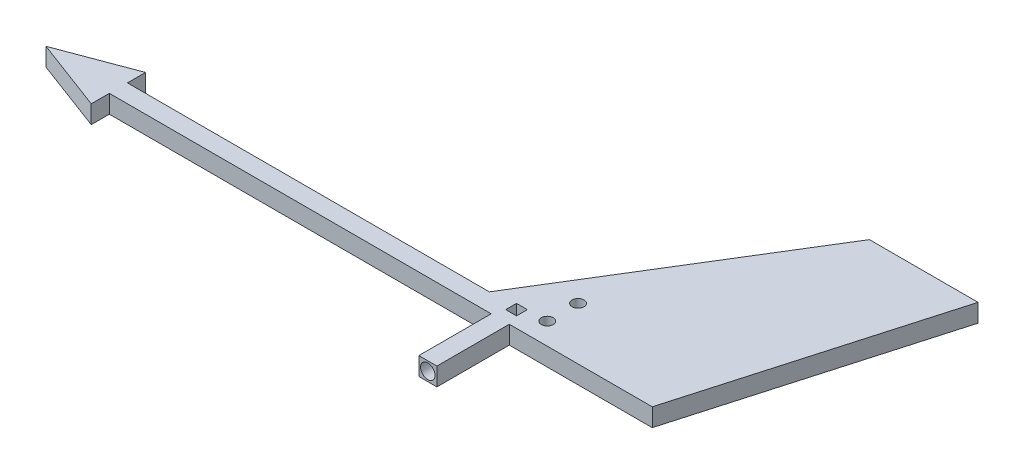
from build123d import *

# Parameters (mm, degrees)
BOSS_EXTRUDE1_DEPTH = 2.5
CUT_EXTRUDE2_DEPTH  = 2.5
SKETCH3_W           = 5
SKETCH3_H           = 5
BOSS_EXTRUDE2_DEPTH = 20
SKETCH4_R           = 2
CUT_EXTRUDE3_DEPTH  = 23
SKETCH6_W           = 3
SKETCH6_H           = 3
CUT_EXTRUDE5_DEPTH  = 4.5
SKETCH7_R           = 1.65
CUT_EXTRUDE6_DEPTH  = 183.978823911


with BuildPart() as part:
    # Sketch1 → Boss-Extrude1 (new, symmetric)
    with BuildSketch(Plane(origin=(0, 0, 0), x_dir=(1, 0, 0), z_dir=(0, 1, 0))):
        Polygon((-20, 0), (0, 7.5), (0, 2.5), (100, 2.5), (140, 67.5), (170, 67.5), (150, -2.5), (0, -2.5), (0, -7.5), align=None)
    extrude(amount=BOSS_EXTRUDE1_DEPTH, both=True)

    # Sketch2 → Cut-Extrude2 (cut)
    with BuildSketch(Plane(origin=(0, -2.5, 0), x_dir=(1, 0, 0), z_dir=(0, 1, 0))):
        Polygon((118.233161507, 12), (116.616580754, 14.8), (113.383419246, 14.8), (111.766838493, 12), (113.383419246, 9.2), (116.616580754, 9.2), align=None)
        Polygon((118.233161507, 3.5), (116.616580754, 6.3), (113.383419246, 6.3), (111.766838493, 3.5), (113.383419246, 0.7), (116.616580754, 0.7), align=None)
    extrude(amount=CUT_EXTRUDE2_DEPTH, mode=Mode.SUBTRACT)

    # Sketch3 → Boss-Extrude2 (add)
    with BuildSketch(Plane.XY.offset(2.5)):
        with Locations((108, 0)):
            Rectangle(SKETCH3_W, SKETCH3_H)
    extrude(amount=BOSS_EXTRUDE2_DEPTH)

    # Sketch4 → Cut-Extrude3 (cut)
    with BuildSketch(Plane.XY.offset(22.5)):
        with Locations((108, 0)):
            Circle(SKETCH4_R)
    extrude(amount=-CUT_EXTRUDE3_DEPTH, mode=Mode.SUBTRACT)

    # Sketch6 → Cut-Extrude5 (cut)
    with BuildSketch(Plane(origin=(0, 2.5, 0), x_dir=(1, 0, 0), z_dir=(0, 1, 0))):
        with Locations((108, 2)):
            Rectangle(SKETCH6_W, SKETCH6_H)
    extrude(amount=-CUT_EXTRUDE5_DEPTH, mode=Mode.SUBTRACT)

    # Sketch7 → Cut-Extrude6 (cut, through all)
    with BuildSketch(Plane(origin=(0, 2.5, 0), x_dir=(1, 0, 0), z_dir=(0, 1, 0))):
        with Locations((115, 3.5)):
            Circle(SKETCH7_R)
        with Locations((115, 12)):
            Circle(SKETCH7_R)
    extrude(amount=-CUT_EXTRUDE6_DEPTH, mode=Mode.SUBTRACT)


solid = part.part
